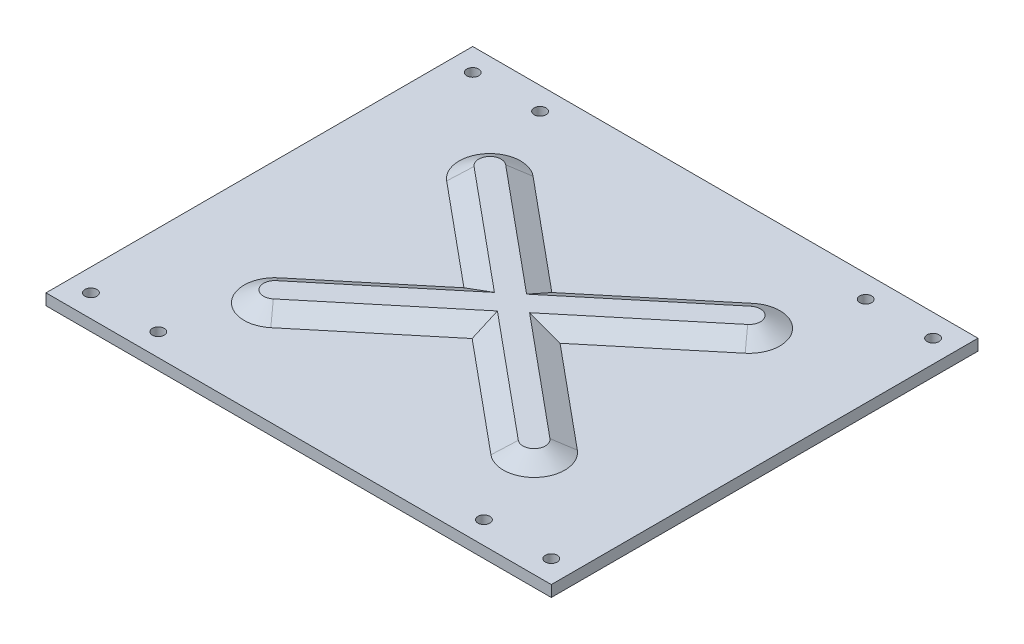
from build123d import *
from OCP.BRepFilletAPI import BRepFilletAPI_MakeChamfer

# Parameters (mm, degrees)
SKETCH1_W           = 225
SKETCH1_H           = 190
SKETCH1_R           = 2.65
BOSS_EXTRUDE1_DEPTH = 5
BOSS_EXTRUDE2_DEPTH = 5
CHAMFER1_SIZE       = 8.660254038
CHAMFER1_SIZE_2     = 5


with BuildPart() as part:
    # Sketch1 → Boss-Extrude1 (new body)
    with BuildSketch(Plane(origin=(0, 0, 0), x_dir=(1, 0, 0), z_dir=(0, 1, 0))):
        with Locations((112.5, 95)):
            Rectangle(SKETCH1_W, SKETCH1_H)
        with Locations(Location((10, 180, 0), (0, 0, 270))):
            Circle(SKETCH1_R, mode=Mode.SUBTRACT)
        with Locations(Location((40, 180, 0), (0, 0, 270))):
            Circle(SKETCH1_R, mode=Mode.SUBTRACT)
        with Locations(Location((185, 180, 0), (0, 0, 270))):
            Circle(SKETCH1_R, mode=Mode.SUBTRACT)
        with Locations(Location((215, 180, 0), (0, 0, 270))):
            Circle(SKETCH1_R, mode=Mode.SUBTRACT)
        with Locations(Location((215, 10, 0), (0, 0, 90))):
            Circle(SKETCH1_R, mode=Mode.SUBTRACT)
        with Locations(Location((185, 10, 0), (0, 0, 90))):
            Circle(SKETCH1_R, mode=Mode.SUBTRACT)
        with Locations(Location((40, 10, 0), (0, 0, 90))):
            Circle(SKETCH1_R, mode=Mode.SUBTRACT)
        with Locations(Location((10, 10, 0), (0, 0, 90))):
            Circle(SKETCH1_R, mode=Mode.SUBTRACT)
    extrude(amount=BOSS_EXTRUDE1_DEPTH)

    # Sketch2 → Boss-Extrude2 (add)
    with BuildSketch(Plane(origin=(0, 5, 0), x_dir=(1, 0, 0), z_dir=(0, 1, 0))):
        with BuildLine():
            Line((51.576473623, 139.026400418), (167.040167682, 43.276019978))
            ThreePointArc((167.040167682, 43.276019978), (174.080636831, 43.933130432), (173.423526377, 50.973599582))
            Line((173.423526377, 50.973599582), (57.959832318, 146.723980022))
            ThreePointArc((57.959832318, 146.723980022), (50.919363169, 146.066869568), (51.576473623, 139.026400418))
        make_face()
    boss_extrude2 = extrude(amount=BOSS_EXTRUDE2_DEPTH)

    # Mirror1: Boss-Extrude2 across plane
    add(boss_extrude2.mirror(Plane(origin=(0, 0, -95), x_dir=(1, 0, 0), z_dir=(0, 0, -1))))

    # Chamfer1
    chamfer1_edges_1 = [part.edges().sort_by_distance(p)[0] for p in [
        (139.770083841, 5, -65.890235846),
    ]]
    chamfer1_side_1 = [part.faces().sort_by_distance(p)[0] for p in [
        (139.706250254, 5, -65.81326005),
    ]]
    chamfer1_edges_2 = [part.edges().sort_by_distance(p)[0] for p in [
        (174.080636831, 5, -43.933130432),
    ]]
    chamfer1_side_2 = [part.faces().sort_by_distance(p)[0] for p in [
        (174.157612628, 5, -43.869296845),
    ]]
    chamfer1_edges_3 = [part.edges().sort_by_distance(p)[0] for p in [
        (146.878196714, 5, -72.986799791),
    ]]
    chamfer1_side_3 = [part.faces().sort_by_distance(p)[0] for p in [
        (146.942030301, 5, -73.063775587),
    ]]
    chamfer1_edges_4 = [part.edges().sort_by_distance(p)[0] for p in [
        (146.878196714, 5, -117.013200209),
    ]]
    chamfer1_side_4 = [part.faces().sort_by_distance(p)[0] for p in [
        (146.942030301, 5, -116.936224413),
    ]]
    chamfer1_edges_5 = [part.edges().sort_by_distance(p)[0] for p in [
        (174.080636831, 5, -146.066869568),
    ]]
    chamfer1_side_5 = [part.faces().sort_by_distance(p)[0] for p in [
        (174.157612628, 5, -146.130703155),
    ]]
    chamfer1_edges_6 = [part.edges().sort_by_distance(p)[0] for p in [
        (139.770083841, 5, -124.109764154),
    ]]
    chamfer1_side_6 = [part.faces().sort_by_distance(p)[0] for p in [
        (139.706250254, 5, -124.18673995),
    ]]
    chamfer1_edges_7 = [part.edges().sort_by_distance(p)[0] for p in [
        (85.229916159, 5, -124.109764154),
    ]]
    chamfer1_side_7 = [part.faces().sort_by_distance(p)[0] for p in [
        (85.293749746, 5, -124.18673995),
    ]]
    chamfer1_edges_8 = [part.edges().sort_by_distance(p)[0] for p in [
        (85.229916159, 5, -65.890235846),
    ]]
    chamfer1_side_8 = [part.faces().sort_by_distance(p)[0] for p in [
        (85.293749746, 5, -65.81326005),
    ]]
    chamfer1_edges_9 = [part.edges().sort_by_distance(p)[0] for p in [
        (50.919363169, 5, -146.066869568),
    ]]
    chamfer1_side_9 = [part.faces().sort_by_distance(p)[0] for p in [
        (50.842387372, 5, -146.130703155),
    ]]
    chamfer1_edges_10 = [part.edges().sort_by_distance(p)[0] for p in [
        (50.919363169, 5, -43.933130432),
    ]]
    chamfer1_side_10 = [part.faces().sort_by_distance(p)[0] for p in [
        (50.842387372, 5, -43.869296845),
    ]]
    chamfer1_edges_11 = [part.edges().sort_by_distance(p)[0] for p in [
        (78.121803286, 5, -117.013200209),
    ]]
    chamfer1_side_11 = [part.faces().sort_by_distance(p)[0] for p in [
        (78.057969699, 5, -116.936224413),
    ]]
    chamfer1_edges_12 = [part.edges().sort_by_distance(p)[0] for p in [
        (78.121803286, 5, -72.986799791),
    ]]
    chamfer1_side_12 = [part.faces().sort_by_distance(p)[0] for p in [
        (78.057969699, 5, -73.063775587),
    ]]
    chamfer1 = BRepFilletAPI_MakeChamfer(part.part.solid().wrapped)
    for e in chamfer1_edges_1:
        chamfer1.Add(CHAMFER1_SIZE - 0.0001, CHAMFER1_SIZE_2 - 0.0001, e.wrapped, chamfer1_side_1[0].wrapped)
    for e in chamfer1_edges_2:
        chamfer1.Add(CHAMFER1_SIZE - 0.0001, CHAMFER1_SIZE_2 - 0.0001, e.wrapped, chamfer1_side_2[0].wrapped)
    for e in chamfer1_edges_3:
        chamfer1.Add(CHAMFER1_SIZE - 0.0001, CHAMFER1_SIZE_2 - 0.0001, e.wrapped, chamfer1_side_3[0].wrapped)
    for e in chamfer1_edges_4:
        chamfer1.Add(CHAMFER1_SIZE - 0.0001, CHAMFER1_SIZE_2 - 0.0001, e.wrapped, chamfer1_side_4[0].wrapped)
    for e in chamfer1_edges_5:
        chamfer1.Add(CHAMFER1_SIZE - 0.0001, CHAMFER1_SIZE_2 - 0.0001, e.wrapped, chamfer1_side_5[0].wrapped)
    for e in chamfer1_edges_6:
        chamfer1.Add(CHAMFER1_SIZE - 0.0001, CHAMFER1_SIZE_2 - 0.0001, e.wrapped, chamfer1_side_6[0].wrapped)
    for e in chamfer1_edges_7:
        chamfer1.Add(CHAMFER1_SIZE - 0.0001, CHAMFER1_SIZE_2 - 0.0001, e.wrapped, chamfer1_side_7[0].wrapped)
    for e in chamfer1_edges_8:
        chamfer1.Add(CHAMFER1_SIZE - 0.0001, CHAMFER1_SIZE_2 - 0.0001, e.wrapped, chamfer1_side_8[0].wrapped)
    for e in chamfer1_edges_9:
        chamfer1.Add(CHAMFER1_SIZE - 0.0001, CHAMFER1_SIZE_2 - 0.0001, e.wrapped, chamfer1_side_9[0].wrapped)
    for e in chamfer1_edges_10:
        chamfer1.Add(CHAMFER1_SIZE - 0.0001, CHAMFER1_SIZE_2 - 0.0001, e.wrapped, chamfer1_side_10[0].wrapped)
    for e in chamfer1_edges_11:
        chamfer1.Add(CHAMFER1_SIZE - 0.0001, CHAMFER1_SIZE_2 - 0.0001, e.wrapped, chamfer1_side_11[0].wrapped)
    for e in chamfer1_edges_12:
        chamfer1.Add(CHAMFER1_SIZE - 0.0001, CHAMFER1_SIZE_2 - 0.0001, e.wrapped, chamfer1_side_12[0].wrapped)
    add(Compound.cast(chamfer1.Shape()), mode=Mode.REPLACE)  # a hair under: the kernel refuses the full size


solid = part.part
